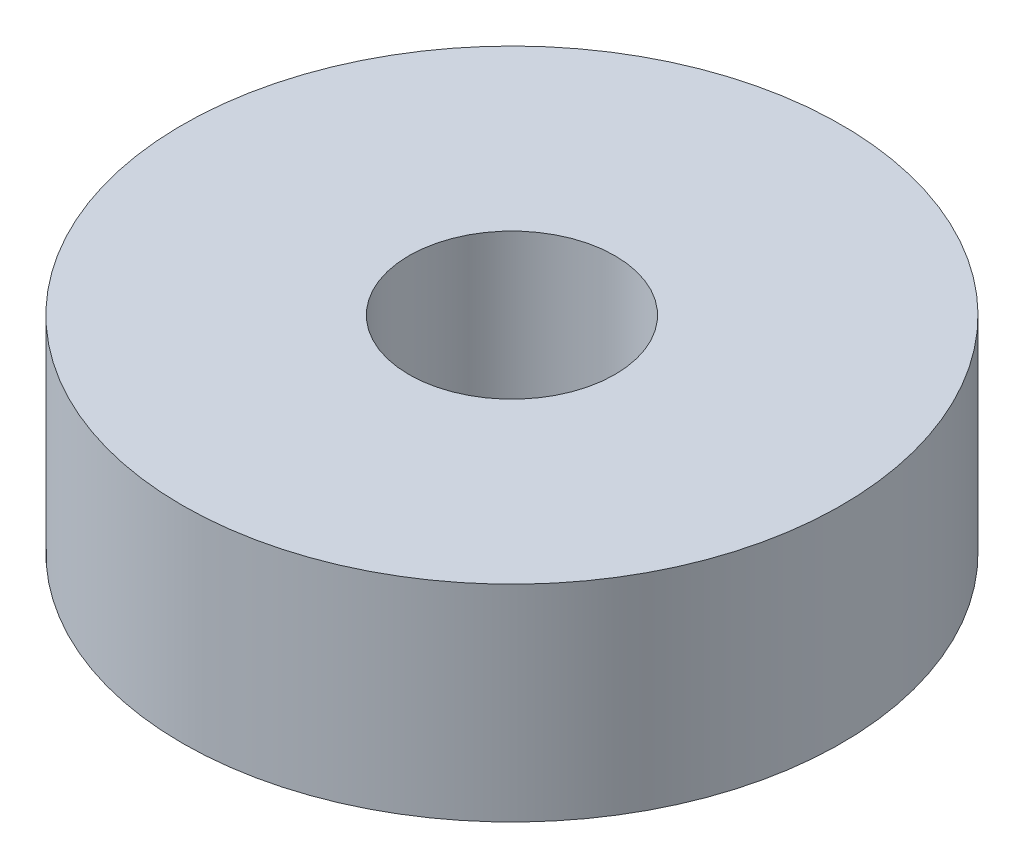
from build123d import *

# Parameters (mm, degrees)
SZKIC1_R                    = 8
SZKIC1_R_2                  = 2.5
DODANIE_WYCI_GNI_CIE1_DEPTH = 5


with BuildPart() as part:
    # Szkic1 → Dodanie-wyciągnięcie1 (new body)
    with BuildSketch(Plane(origin=(0, 0, 0), x_dir=(1, 0, 0), z_dir=(0, 1, 0))):
        Circle(SZKIC1_R)
        Circle(SZKIC1_R_2, mode=Mode.SUBTRACT)
    extrude(amount=DODANIE_WYCI_GNI_CIE1_DEPTH)


solid = part.part
